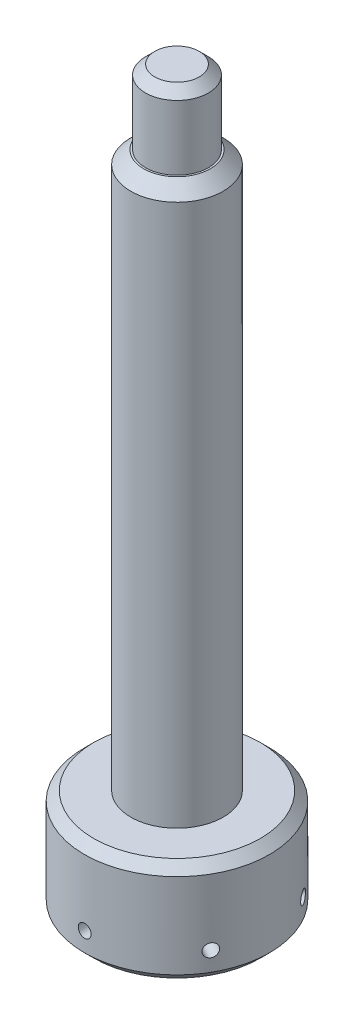
from build123d import *

# Parameters (mm, degrees)
SKETCH1_R           = 6.35
EXTRUDE1_DEPTH      = 4.572
EXTRUDE4_START      = 1.27
SKETCH4_R           = 6.35
EXTRUDE4_DEPTH      = 1.27
SKETCH5_R           = 6.35
EXTRUDE5_DEPTH      = 1.27
SKETCH2_R           = 3.175
EXTRUDE2_DEPTH      = 38.1
SKETCH3_R           = 2.159
EXTRUDE3_DEPTH      = 5.08
CHAMFER1_SIZE       = 0.635
CHAMFER2_SIZE       = 0.889
CHAMFER3_SIZE       = 0.635
EXTRUDE7_DEPTH      = 50.837751595
EXTRUDE7_DEPTH_BACK = 50.837751595
SKETCH7_R           = 0.4445
EXTRUDE8_DEPTH      = 50.837751595
CIRPATTERN1_COUNT   = 3


with BuildPart() as part:
    # Sketch1 → Extrude1 (new body)
    with BuildSketch(Plane(origin=(0, 0, 0), x_dir=(1, 0, 0), z_dir=(0, 1, 0))):
        Circle(SKETCH1_R)
    extrude(amount=EXTRUDE1_DEPTH)

    # Sketch4 → Extrude4 (add)
    with BuildSketch(Plane.XZ.offset(EXTRUDE4_START)):
        Circle(SKETCH4_R)
    extrude(amount=-EXTRUDE4_DEPTH)

    # Sketch5 → Extrude5 (add)
    with BuildSketch(Plane(origin=(0, 4.572, 0), x_dir=(1, 0, 0), z_dir=(0, 1, 0))):
        Circle(SKETCH5_R)
    extrude(amount=EXTRUDE5_DEPTH)

    # Sketch2 → Extrude2 (add)
    with BuildSketch(Plane(origin=(0, 5.842, 0), x_dir=(1, 0, 0), z_dir=(0, 1, 0))):
        Circle(SKETCH2_R)
    extrude(amount=EXTRUDE2_DEPTH)

    # Sketch3 → Extrude3 (add)
    with BuildSketch(Plane(origin=(0, 43.942, 0), x_dir=(1, 0, 0), z_dir=(0, 1, 0))):
        Circle(SKETCH3_R)
    extrude(amount=EXTRUDE3_DEPTH)

    # Chamfer1
    chamfer1_edges = [part.edges().sort_by_distance(p)[0] for p in [
        (-6.35, -1.27, 0),
        (-6.35, 5.842, 0),
    ]]
    chamfer(chamfer1_edges, length=CHAMFER1_SIZE)

    # Chamfer2
    chamfer2_edges = [part.edges().sort_by_distance(p)[0] for p in [
        (-3.175, 43.942, 0),
    ]]
    chamfer(chamfer2_edges, length=CHAMFER2_SIZE)

    # Chamfer3
    chamfer3_edges = [part.edges().sort_by_distance(p)[0] for p in [
        (-2.159, 49.022, 0),
    ]]
    chamfer(chamfer3_edges, length=CHAMFER3_SIZE)

    # Sketch6 → Extrude7 (cut, two sides: drawn at the far end of the back side and taken through both)
    with BuildSketch(Plane.XY.offset(-EXTRUDE7_DEPTH_BACK)):
        Polygon((0, -0.635), (-0.635, -1.27), (0.635, -1.27), align=None)
    extrude(amount=EXTRUDE7_DEPTH + EXTRUDE7_DEPTH_BACK, mode=Mode.SUBTRACT)

    # Sketch7 → Extrude8 (cut, symmetric)
    with BuildSketch(Plane.XY):
        with Locations((0, 0.679875601)):
            Circle(SKETCH7_R)
    extrude8 = extrude(amount=EXTRUDE8_DEPTH, both=True, mode=Mode.SUBTRACT)

    # CirPattern1: Extrude8 ×3 about axis
    cirpattern1_axis = Axis((0, 43.942, 0), (0, -1, 0))
    for i in range(1, CIRPATTERN1_COUNT):
        add(extrude8.rotate(cirpattern1_axis, i * 360 / CIRPATTERN1_COUNT), mode=Mode.SUBTRACT)


solid = part.part
